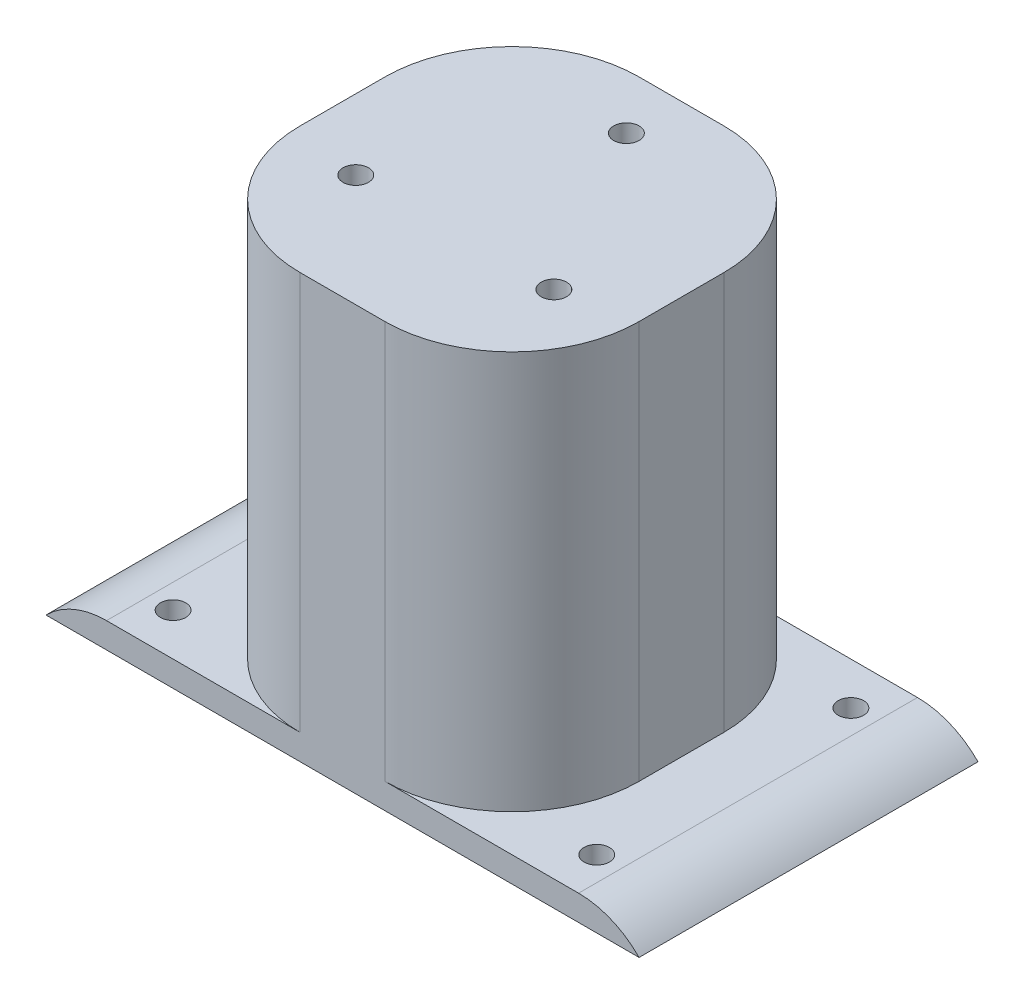
from build123d import *

# Parameters (mm, degrees)
SKETCH1_W           = 40
SKETCH1_H           = 40
SKETCH1_R           = 1.5
BOSS_EXTRUDE1_DEPTH = 50
SKETCH1_3_W         = 15
SKETCH1_3_H         = 40
SKETCH1_3_R         = 1.5
BOSS_EXTRUDE2_DEPTH = 3
FILLET1_R           = 10
FILLET2_R           = 15


with BuildPart() as part:
    # Sketch1 → Boss-Extrude1 (new body)
    with BuildSketch(Plane(origin=(0, 0, 0), x_dir=(1, 0, 0), z_dir=(0, 1, 0))):
        Rectangle(SKETCH1_W, SKETCH1_H)
        with Locations(Location((-11.691342951, -6.75, 0), (0, 0, 270))):
            Circle(SKETCH1_R, mode=Mode.SUBTRACT)
        with Locations(Location((11.691342951, -6.75, 0), (0, 0, 270))):
            Circle(SKETCH1_R, mode=Mode.SUBTRACT)
        with Locations(Location((0, 13.5, 0), (0, 0, 270))):
            Circle(SKETCH1_R, mode=Mode.SUBTRACT)
    extrude(amount=BOSS_EXTRUDE1_DEPTH)

    # Sketch1<3> → Boss-Extrude2 (add)
    # profile 1 of 2: a face of its own
    with BuildSketch(Plane(origin=(0, 0, 0), x_dir=(1, 0, 0), z_dir=(0, 1, 0))):
        with Locations((-27.5, 0)):
            Rectangle(SKETCH1_3_W, SKETCH1_3_H)
        with Locations(Location((-25, -15, 0), (0, 0, 270))):
            Circle(SKETCH1_3_R, mode=Mode.SUBTRACT)
        with Locations(Location((-25, 15, 0), (0, 0, 270))):
            Circle(SKETCH1_3_R, mode=Mode.SUBTRACT)
    # profile 2 of 2: a face of its own
    with BuildSketch(Plane(origin=(0, 0, 0), x_dir=(1, 0, 0), z_dir=(0, 1, 0))):
        with Locations((27.5, 0)):
            Rectangle(SKETCH1_3_W, SKETCH1_3_H)
        with Locations(Location((25, -15, 0), (0, 0, 270))):
            Circle(SKETCH1_3_R, mode=Mode.SUBTRACT)
        with Locations(Location((25, 15, 0), (0, 0, 270))):
            Circle(SKETCH1_3_R, mode=Mode.SUBTRACT)
    extrude(amount=BOSS_EXTRUDE2_DEPTH)

    # Fillet1
    # the kernel refuses this fillet: 10 mm, written as the material it takes off along each edge
    with BuildSketch(Plane(origin=(35, 3, 37.853571071), x_dir=(0, -1, 0), z_dir=(0, 0, -1))) as fillet1_piece_1:
        with BuildLine():
            CenterArc((10, 7.141428429), FILLET1_R, 180, 45.572995999)
            Line((0, 7.141428429), (-0.2, 7.141428429))
            Line((-0.2, 7.141428429), (-0.2, 0))
            Line((-0.2, 0), (0, -0.2))
            ThreePointArc((0, -0.2), (1.5, -0.2), (2.86, -0.142828569))
            Line((2.86, -0.142828569), (3, 0))
        make_face()
    extrude(amount=75.707142143, mode=Mode.SUBTRACT)
    with BuildSketch(Plane(origin=(-35, 3, -37.853571071), x_dir=(1, 0, 0), z_dir=(0, 0, 1))) as fillet1_piece_2:
        with BuildLine():
            CenterArc((7.141428429, -10), FILLET1_R, 90, 45.572995999)
            Line((0, -3), (-0.142828569, -2.86))
            ThreePointArc((-0.142828569, -2.86), (-0.2, -1.5), (-0.2, 0))
            Line((-0.2, 0), (0, 0.2))
            Line((0, 0.2), (7.141428429, 0.2))
            Line((7.141428429, 0.2), (7.141428429, 0))
        make_face()
    extrude(amount=75.707142143, mode=Mode.SUBTRACT)

    # Fillet2
    fillet2_edges = [part.edges().sort_by_distance(p)[0] for p in [
        (-20, 26.5, -20),
        (20, 26.5, -20),
        (20, 26.5, 20),
        (-20, 26.5, 20),
    ]]
    fillet(fillet2_edges, radius=FILLET2_R)


solid = part.part
